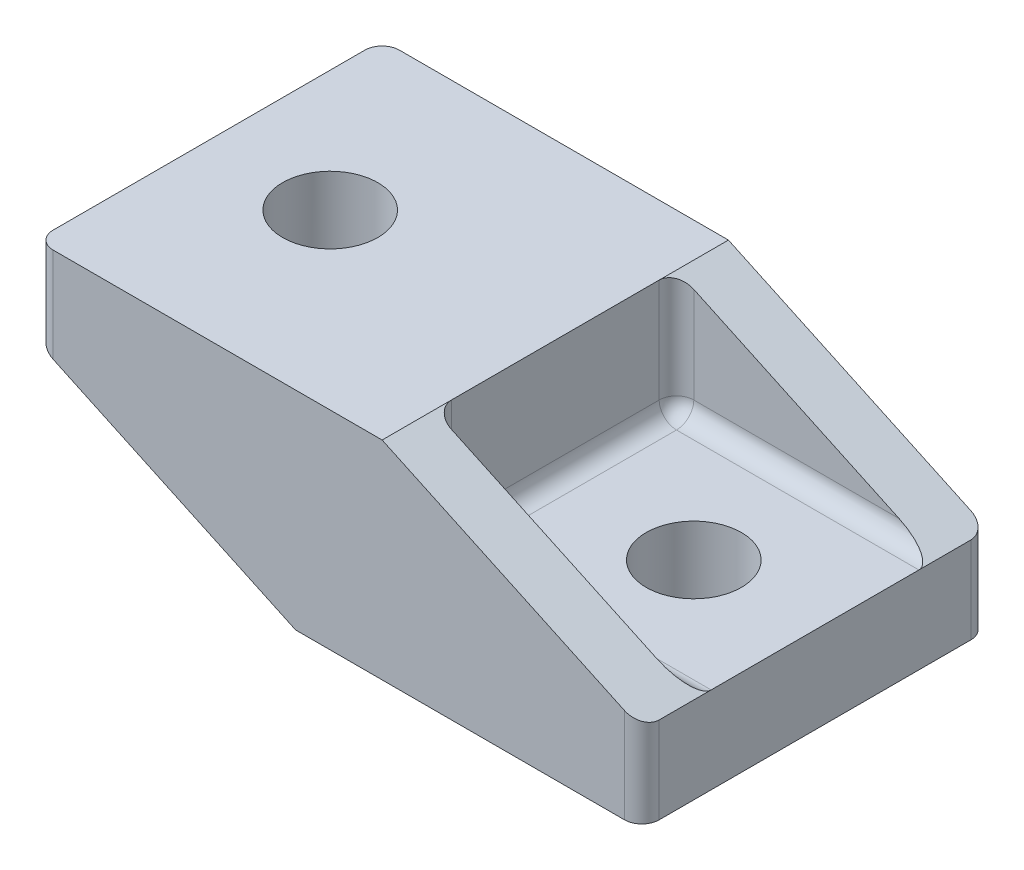
from build123d import *

# Parameters (mm, degrees)
BOSS_EXTRUDE1_DEPTH = 10
SKETCH2_R           = 2.75
CUT_EXTRUDE1_DEPTH  = 26.377155081
SKETCH3_R           = 2.75
CUT_EXTRUDE2_DEPTH  = 24.430749028
RIB7_REACH          = 32.725
SKETCH5_WALL_W      = 80.00211134
SKETCH5_WALL_H      = 3
RIB8_REACH          = 32.725
SKETCH6_WALL_W      = 80.00211134
SKETCH6_WALL_H      = 3
FILLET1_R           = 1
FILLET2_R           = 1


with BuildPart() as part:
    # Sketch1 → Boss-Extrude1 (new, symmetric)
    with BuildSketch(Plane.XY):
        Polygon((0, 0), (0, 7), (-15, 7), (-15, 12), (5, 12), (5, 5), (20, 5), (20, 0), align=None)
    extrude(amount=BOSS_EXTRUDE1_DEPTH, both=True)

    # Sketch2 → Cut-Extrude1 (cut, through all)
    with BuildSketch(Plane(origin=(0, 12, 0), x_dir=(1, 0, 0), z_dir=(0, 1, 0))):
        with Locations((-8, 0)):
            Circle(SKETCH2_R)
    extrude(amount=-CUT_EXTRUDE1_DEPTH, mode=Mode.SUBTRACT)

    # Sketch3 → Cut-Extrude2 (cut, through all)
    with BuildSketch(Plane(origin=(0, 5, 0), x_dir=(1, 0, 0), z_dir=(0, 1, 0))):
        with Locations((13, 0)):
            Circle(SKETCH3_R)
    extrude(amount=-CUT_EXTRUDE2_DEPTH, mode=Mode.SUBTRACT)

    # Sketch5 wall → Rib7 (add, up to next)
    with BuildSketch(Plane(origin=(12.5, 8.5, -10), x_dir=(-0.906183139995, 0.422885465331, 0), z_dir=(0.422885465331, 0.906183139995, 0)), mode=Mode.PRIVATE) as rib7_sk1:
        with Locations((0, 1.5)):
            Rectangle(SKETCH5_WALL_W, SKETCH5_WALL_H)
    rib7_tool1 = extrude(rib7_sk1.sketch, amount=-RIB7_REACH, mode=Mode.PRIVATE) - part.part
    rib7 = rib7_tool1.solids().sort_by_distance((12.5, 8.5, -10))[0]
    add(rib7)

    # Sketch6 wall → Rib8 (add, up to next)
    with BuildSketch(Plane(origin=(-7.5, 3.5, -10), x_dir=(0.906183139995, -0.422885465331, 0), z_dir=(-0.422885465331, -0.906183139995, 0)), mode=Mode.PRIVATE) as rib8_sk1:
        with Locations((0, 1.5)):
            Rectangle(SKETCH6_WALL_W, SKETCH6_WALL_H)
    rib8_tool1 = extrude(rib8_sk1.sketch, amount=-RIB8_REACH, mode=Mode.PRIVATE) - part.part
    rib8 = rib8_tool1.solids().sort_by_distance((-7.5, 3.5, -10))[0]
    add(rib8)

    # Mirror1: Rib7, Rib8 across plane
    add(rib7.mirror(Plane.XY))
    add(rib8.mirror(Plane.XY))

    # Fillet1
    fillet1_edges = [part.edges().sort_by_distance(p)[0] for p in [
        (5, 8.5, -7),
        (12.5, 5, -7),
        (12.5, 5, 7),
        (5, 8.5, 7),
        (5, 5, 0),
        (0, 7, 0),
        (0, 3.5, -7),
        (0, 3.5, 7),
        (-7.5, 7, 7),
        (-7.5, 7, -7),
    ]]
    fillet(fillet1_edges, radius=FILLET1_R)

    # Fillet2
    fillet2_edges = [part.edges().sort_by_distance(p)[0] for p in [
        (20, 2.5, -10),
        (20, 2.5, 10),
        (-15, 9.5, 10),
        (-15, 9.5, -10),
    ]]
    fillet(fillet2_edges, radius=FILLET2_R)


solid = part.part
